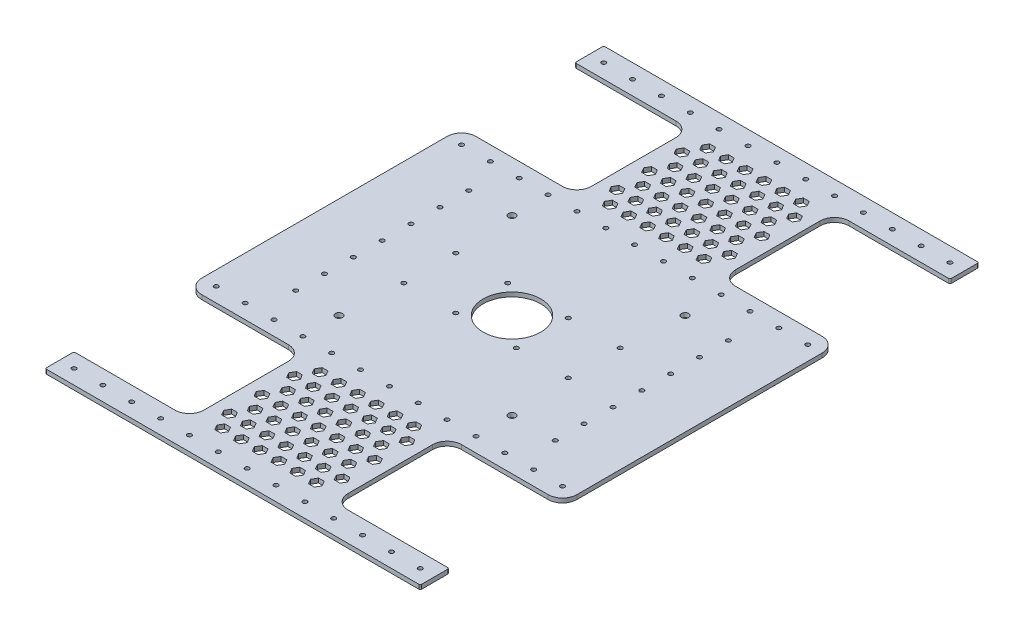
from build123d import *

# Parameters (mm, degrees)
EXTRUDE_1_DEPTH     = 3
CUT_EXTRUDE_2_DEPTH = 10
OTHER_1_DEPTH       = 3
FILLET_1_R          = 10
FILLET_2_R          = 1
SKETCH_5_R          = 1.5
CUT_EXTRUDE_3_DEPTH = 10
SKETCH_8_R          = 1.5
CUT_EXTRUDE_4_DEPTH = 234.216551728
SKETCH_11_R         = 20
CUT_EXTRUDE_6_DEPTH = 10
SKETCH_13_R         = 2.5
SKETCH_13_R_2       = 1.5
CUT_EXTRUDE_7_DEPTH = 10


# Read off the part's stored shape, not the designer's step: 填充阵列1
with BuildPart() as part:
    # 草图1 → 凸台-拉伸1 (new body)
    with BuildSketch(Plane(origin=(0, 0, 0), x_dir=(1, 0, 0), z_dir=(0, 1, 0))):
        with BuildLine():
            Line((-130, -193.6), (-50, -193.6))
            Line((-50, -193.6), (50, -193.6))
            Line((50, -193.6), (130, -193.6))
            Line((130, -193.6), (130, -173.6))
            Line((130, -173.6), (60, -173.6))
            ThreePointArc((60, -173.6), (52.928932188, -170.671067812), (50, -163.6))
            Line((50, -163.6), (50, -105))
            ThreePointArc((50, -105), (52.928932188, -97.928932188), (60, -95))
            Line((60, -95), (130, -95))
            Line((130, -95), (130, -75))
            Line((130, -75), (130, 75))
            Line((130, 75), (130, 95))
            Line((130, 95), (60, 95))
            ThreePointArc((60, 95), (52.928932188, 97.928932188), (50, 105))
            Line((50, 105), (50, 163.6))
            ThreePointArc((50, 163.6), (52.928932188, 170.671067812), (60, 173.6))
            Line((60, 173.6), (130, 173.6))
            Line((130, 173.6), (130, 193.6))
            Line((130, 193.6), (50, 193.6))
            Line((50, 193.6), (-50, 193.6))
            Line((-50, 193.6), (-130, 193.6))
            Line((-130, 193.6), (-130, 173.6))
            Line((-130, 173.6), (-60, 173.6))
            ThreePointArc((-60, 173.6), (-52.928932188, 170.671067812), (-50, 163.6))
            Line((-50, 163.6), (-50, 105))
            ThreePointArc((-50, 105), (-52.928932188, 97.928932188), (-60, 95))
            Line((-60, 95), (-130, 95))
            Line((-130, 95), (-130, 75))
            Line((-130, 75), (-130, -75))
            Line((-130, -75), (-130, -95))
            Line((-130, -95), (-60, -95))
            ThreePointArc((-60, -95), (-52.928932188, -97.928932188), (-50, -105))
            Line((-50, -105), (-50, -163.6))
            ThreePointArc((-50, -163.6), (-52.928932188, -170.671067812), (-60, -173.6))
            Line((-60, -173.6), (-130, -173.6))
            Line((-130, -173.6), (-130, -193.6))
        make_face()
    extrude(amount=EXTRUDE_1_DEPTH)

    # 草图4 → 切除-拉伸2 (cut)
    with BuildSketch(Plane(origin=(0, 3, 0), x_dir=(1, 0, 0), z_dir=(0, 1, 0))):
        Polygon((4, 134.3), (2, 137.764101615), (-2, 137.764101615), (-4, 134.3), (-2, 130.835898385), (2, 130.835898385), align=None)
    cut_extrude_2 = extrude(amount=-CUT_EXTRUDE_2_DEPTH, mode=Mode.SUBTRACT)

    # 填充阵列1 outline → 填充阵列1 (cut)
    with BuildSketch(Plane(origin=(0, 0, 0), x_dir=(1, 0, 0), z_dir=(0, 1, 0))):
        Polygon((-21.5, 97.060907637), (-17.5, 97.060907637), (-15.5, 100.525009252), (-17.5, 103.989110868), (-21.5, 103.989110868), (-23.5, 100.525009252), align=None)
        Polygon((-15, 108.319237886), (-11, 108.319237886), (-9, 111.783339502), (-11, 115.247441117), (-15, 115.247441117), (-17, 111.783339502), align=None)
        Polygon((-8.5, 119.577568136), (-4.5, 119.577568136), (-2.5, 123.041669751), (-4.5, 126.505771366), (-8.5, 126.505771366), (-10.5, 123.041669751), align=None)
        Polygon((4.5, 142.094228634), (8.5, 142.094228634), (10.5, 145.558330249), (8.5, 149.022431864), (4.5, 149.022431864), (2.5, 145.558330249), align=None)
        Polygon((11, 153.352558883), (15, 153.352558883), (17, 156.816660498), (15, 160.280762114), (11, 160.280762114), (9, 156.816660498), align=None)
        Polygon((17.5, 164.610889132), (21.5, 164.610889132), (23.5, 168.074990748), (21.5, 171.539092363), (17.5, 171.539092363), (15.5, 168.074990748), align=None)
        Polygon((22, 134.3), (24, 130.835898385), (28, 130.835898385), (30, 134.3), (28, 137.764101615), (24, 137.764101615), align=None)
        Polygon((35, 134.3), (37, 130.835898385), (41, 130.835898385), (43, 134.3), (41, 137.764101615), (37, 137.764101615), align=None)
        Polygon((-17, 134.3), (-15, 130.835898385), (-11, 130.835898385), (-9, 134.3), (-11, 137.764101615), (-15, 137.764101615), align=None)
        Polygon((-43, 134.3), (-41, 130.835898385), (-37, 130.835898385), (-35, 134.3), (-37, 137.764101615), (-41, 137.764101615), align=None)
        Polygon((-30, 134.3), (-28, 130.835898385), (-24, 130.835898385), (-22, 134.3), (-24, 137.764101615), (-28, 137.764101615), align=None)
        Polygon((9, 134.3), (11, 130.835898385), (15, 130.835898385), (17, 134.3), (15, 137.764101615), (11, 137.764101615), align=None)
        Polygon((17.5, 103.989110868), (15.5, 100.525009252), (17.5, 97.060907637), (21.5, 97.060907637), (23.5, 100.525009252), (21.5, 103.989110868), align=None)
        Polygon((11, 115.247441117), (9, 111.783339502), (11, 108.319237886), (15, 108.319237886), (17, 111.783339502), (15, 115.247441117), align=None)
        Polygon((-15, 160.280762114), (-17, 156.816660498), (-15, 153.352558883), (-11, 153.352558883), (-9, 156.816660498), (-11, 160.280762114), align=None)
        Polygon((-8.5, 149.022431864), (-10.5, 145.558330249), (-8.5, 142.094228634), (-4.5, 142.094228634), (-2.5, 145.558330249), (-4.5, 149.022431864), align=None)
        Polygon((-21.5, 171.539092363), (-23.5, 168.074990748), (-21.5, 164.610889132), (-17.5, 164.610889132), (-15.5, 168.074990748), (-17.5, 171.539092363), align=None)
        Polygon((4.5, 126.505771366), (2.5, 123.041669751), (4.5, 119.577568136), (8.5, 119.577568136), (10.5, 123.041669751), (8.5, 126.505771366), align=None)
        Polygon((-41, 153.352558883), (-37, 153.352558883), (-35, 156.816660498), (-37, 160.280762114), (-41, 160.280762114), (-43, 156.816660498), align=None)
        Polygon((-34.5, 164.610889132), (-30.5, 164.610889132), (-28.5, 168.074990748), (-30.5, 171.539092363), (-34.5, 171.539092363), (-36.5, 168.074990748), align=None)
        Polygon((35, 156.816660498), (37, 153.352558883), (41, 153.352558883), (43, 156.816660498), (41, 160.280762114), (37, 160.280762114), align=None)
        Polygon((-30, 156.816660498), (-28, 153.352558883), (-24, 153.352558883), (-22, 156.816660498), (-24, 160.280762114), (-28, 160.280762114), align=None)
        Polygon((22, 156.816660498), (24, 153.352558883), (28, 153.352558883), (30, 156.816660498), (28, 160.280762114), (24, 160.280762114), align=None)
        Polygon((-4, 156.816660498), (-2, 153.352558883), (2, 153.352558883), (4, 156.816660498), (2, 160.280762114), (-2, 160.280762114), align=None)
        Polygon((-21.5, 126.505771366), (-23.5, 123.041669751), (-21.5, 119.577568136), (-17.5, 119.577568136), (-15.5, 123.041669751), (-17.5, 126.505771366), align=None)
        Polygon((-34.5, 149.022431864), (-36.5, 145.558330249), (-34.5, 142.094228634), (-30.5, 142.094228634), (-28.5, 145.558330249), (-30.5, 149.022431864), align=None)
        Polygon((-8.5, 103.989110868), (-10.5, 100.525009252), (-8.5, 97.060907637), (-4.5, 97.060907637), (-2.5, 100.525009252), (-4.5, 103.989110868), align=None)
        Polygon((30.5, 142.094228634), (34.5, 142.094228634), (36.5, 145.558330249), (34.5, 149.022431864), (30.5, 149.022431864), (28.5, 145.558330249), align=None)
        Polygon((17.5, 119.577568136), (21.5, 119.577568136), (23.5, 123.041669751), (21.5, 126.505771366), (17.5, 126.505771366), (15.5, 123.041669751), align=None)
        Polygon((4.5, 97.060907637), (8.5, 97.060907637), (10.5, 100.525009252), (8.5, 103.989110868), (4.5, 103.989110868), (2.5, 100.525009252), align=None)
        Polygon((30.5, 171.539092363), (28.5, 168.074990748), (30.5, 164.610889132), (34.5, 164.610889132), (36.5, 168.074990748), (34.5, 171.539092363), align=None)
        Polygon((24, 108.319237886), (28, 108.319237886), (30, 111.783339502), (28, 115.247441117), (24, 115.247441117), (22, 111.783339502), align=None)
        Polygon((30.5, 119.577568136), (34.5, 119.577568136), (36.5, 123.041669751), (34.5, 126.505771366), (30.5, 126.505771366), (28.5, 123.041669751), align=None)
        Polygon((28.5, 100.525009252), (30.5, 97.060907637), (34.5, 97.060907637), (36.5, 100.525009252), (34.5, 103.989110868), (30.5, 103.989110868), align=None)
        Polygon((-36.5, 100.525009252), (-34.5, 97.060907637), (-30.5, 97.060907637), (-28.5, 100.525009252), (-30.5, 103.989110868), (-34.5, 103.989110868), align=None)
        Polygon((35, 111.783339502), (37, 108.319237886), (41, 108.319237886), (43, 111.783339502), (41, 115.247441117), (37, 115.247441117), align=None)
        Polygon((-30, 111.783339502), (-28, 108.319237886), (-24, 108.319237886), (-22, 111.783339502), (-24, 115.247441117), (-28, 115.247441117), align=None)
        Polygon((-43, 111.783339502), (-41, 108.319237886), (-37, 108.319237886), (-35, 111.783339502), (-37, 115.247441117), (-41, 115.247441117), align=None)
        Polygon((-4, 111.783339502), (-2, 108.319237886), (2, 108.319237886), (4, 111.783339502), (2, 115.247441117), (-2, 115.247441117), align=None)
        Polygon((-8.5, 171.539092363), (-10.5, 168.074990748), (-8.5, 164.610889132), (-4.5, 164.610889132), (-2.5, 168.074990748), (-4.5, 171.539092363), align=None)
        Polygon((-36.5, 123.041669751), (-34.5, 119.577568136), (-30.5, 119.577568136), (-28.5, 123.041669751), (-30.5, 126.505771366), (-34.5, 126.505771366), align=None)
        Polygon((17.5, 149.022431864), (15.5, 145.558330249), (17.5, 142.094228634), (21.5, 142.094228634), (23.5, 145.558330249), (21.5, 149.022431864), align=None)
        Polygon((4.5, 171.539092363), (2.5, 168.074990748), (4.5, 164.610889132), (8.5, 164.610889132), (10.5, 168.074990748), (8.5, 171.539092363), align=None)
        Polygon((-23.5, 145.558330249), (-21.5, 142.094228634), (-17.5, 142.094228634), (-15.5, 145.558330249), (-17.5, 149.022431864), (-21.5, 149.022431864), align=None)
    other_1 = extrude(amount=OTHER_1_DEPTH, mode=Mode.SUBTRACT)

    # 镜向1: 切除-拉伸2, 填充阵列1 across plane
    add(cut_extrude_2.mirror(Plane(origin=(0, 0, 0), x_dir=(1, 0, 0), z_dir=(0, 0, -1))), mode=Mode.SUBTRACT)
    add(other_1.mirror(Plane(origin=(0, 0, 0), x_dir=(1, 0, 0), z_dir=(0, 0, -1))), mode=Mode.SUBTRACT)

    # 圆角1
    fillet_1_edges = [part.edges().sort_by_distance(p)[0] for p in [
        (130, 1.5, -95),
        (130, 1.5, 95),
        (-130, 1.5, 95),
        (-130, 1.5, -95),
    ]]
    fillet(fillet_1_edges, radius=FILLET_1_R)

    # 圆角2
    fillet_2_edges = [part.edges().sort_by_distance(p)[0] for p in [
        (-130, 1.5, -173.6),
        (-130, 1.5, -193.6),
        (130, 1.5, -193.6),
        (130, 1.5, -173.6),
        (130, 1.5, 173.6),
        (130, 1.5, 193.6),
        (-130, 1.5, 193.6),
        (-130, 1.5, 173.6),
    ]]
    fillet(fillet_2_edges, radius=FILLET_2_R)

    # 草图5 → 切除-拉伸3 (cut)
    with BuildSketch(Plane(origin=(0, 3, 0), x_dir=(1, 0, 0), z_dir=(0, 1, 0))):
        with Locations(Location((0, 183.6, 0), (0, 0, 270))):
            Circle(SKETCH_5_R)
        with Locations(Location((20, 183.6, 0), (0, 0, 270))):
            Circle(SKETCH_5_R)
        with Locations(Location((40, 183.6, 0), (0, 0, 270))):
            Circle(SKETCH_5_R)
        with Locations(Location((60, 183.6, 0), (0, 0, 270))):
            Circle(SKETCH_5_R)
        with Locations(Location((80, 183.6, 0), (0, 0, 270))):
            Circle(SKETCH_5_R)
        with Locations(Location((100, 183.6, 0), (0, 0, 270))):
            Circle(SKETCH_5_R)
        with Locations(Location((120, 183.6, 0), (0, 0, 270))):
            Circle(SKETCH_5_R)
        with Locations((140, 183.6)):
            Circle(SKETCH_5_R)
        with Locations((160, 183.6)):
            Circle(SKETCH_5_R)
        with Locations((180, 183.6)):
            Circle(SKETCH_5_R)
        with Locations((200, 183.6)):
            Circle(SKETCH_5_R)
        with Locations((220, 183.6)):
            Circle(SKETCH_5_R)
        with Locations((240, 183.6)):
            Circle(SKETCH_5_R)
        with Locations((260, 183.6)):
            Circle(SKETCH_5_R)
        with Locations((280, 183.6)):
            Circle(SKETCH_5_R)
        with Locations(Location((-20, 183.6, 0), (0, 0, 270))):
            Circle(SKETCH_5_R)
        with Locations(Location((-40, 183.6, 0), (0, 0, 270))):
            Circle(SKETCH_5_R)
        with Locations(Location((-60, 183.6, 0), (0, 0, 270))):
            Circle(SKETCH_5_R)
        with Locations(Location((-80, 183.6, 0), (0, 0, 270))):
            Circle(SKETCH_5_R)
        with Locations(Location((-100, 183.6, 0), (0, 0, 270))):
            Circle(SKETCH_5_R)
        with Locations(Location((-120, 183.6, 0), (0, 0, 270))):
            Circle(SKETCH_5_R)
        with Locations((-140, 183.6)):
            Circle(SKETCH_5_R)
        with Locations((-160, 183.6)):
            Circle(SKETCH_5_R)
        with Locations((-180, 183.6)):
            Circle(SKETCH_5_R)
        with Locations((-200, 183.6)):
            Circle(SKETCH_5_R)
        with Locations((-220, 183.6)):
            Circle(SKETCH_5_R)
        with Locations((-240, 183.6)):
            Circle(SKETCH_5_R)
        with Locations((-240, -183.6)):
            Circle(SKETCH_5_R)
        with Locations((-220, -183.6)):
            Circle(SKETCH_5_R)
        with Locations((-200, -183.6)):
            Circle(SKETCH_5_R)
        with Locations((-180, -183.6)):
            Circle(SKETCH_5_R)
        with Locations((-160, -183.6)):
            Circle(SKETCH_5_R)
        with Locations((-140, -183.6)):
            Circle(SKETCH_5_R)
        with Locations(Location((-120, -183.6, 0), (0, 0, 270))):
            Circle(SKETCH_5_R)
        with Locations(Location((-100, -183.6, 0), (0, 0, 270))):
            Circle(SKETCH_5_R)
        with Locations(Location((-80, -183.6, 0), (0, 0, 270))):
            Circle(SKETCH_5_R)
        with Locations(Location((-60, -183.6, 0), (0, 0, 270))):
            Circle(SKETCH_5_R)
        with Locations(Location((-40, -183.6, 0), (0, 0, 270))):
            Circle(SKETCH_5_R)
        with Locations(Location((-20, -183.6, 0), (0, 0, 270))):
            Circle(SKETCH_5_R)
        with Locations(Location((40, -183.6, 0), (0, 0, 270))):
            Circle(SKETCH_5_R)
        with Locations(Location((20, -183.6, 0), (0, 0, 270))):
            Circle(SKETCH_5_R)
        with Locations(Location((0, -183.6, 0), (0, 0, 270))):
            Circle(SKETCH_5_R)
        with Locations(Location((60, -183.6, 0), (0, 0, 270))):
            Circle(SKETCH_5_R)
        with Locations(Location((80, -183.6, 0), (0, 0, 270))):
            Circle(SKETCH_5_R)
        with Locations(Location((100, -183.6, 0), (0, 0, 270))):
            Circle(SKETCH_5_R)
        with Locations(Location((120, -183.6, 0), (0, 0, 270))):
            Circle(SKETCH_5_R)
        with Locations((140, -183.6)):
            Circle(SKETCH_5_R)
        with Locations((160, -183.6)):
            Circle(SKETCH_5_R)
        with Locations((180, -183.6)):
            Circle(SKETCH_5_R)
        with Locations((200, -183.6)):
            Circle(SKETCH_5_R)
        with Locations((220, -183.6)):
            Circle(SKETCH_5_R)
        with Locations((240, -183.6)):
            Circle(SKETCH_5_R)
        with Locations((260, -183.6)):
            Circle(SKETCH_5_R)
        with Locations((280, -183.6)):
            Circle(SKETCH_5_R)
        with Locations((-240, 85)):
            Circle(SKETCH_5_R)
        with Locations((-220, 85)):
            Circle(SKETCH_5_R)
        with Locations((-200, 85)):
            Circle(SKETCH_5_R)
        with Locations((-180, 85)):
            Circle(SKETCH_5_R)
        with Locations((-160, 85)):
            Circle(SKETCH_5_R)
        with Locations((-140, 85)):
            Circle(SKETCH_5_R)
        with Locations(Location((-120, 85, 0), (0, 0, 270))):
            Circle(SKETCH_5_R)
        with Locations(Location((-100, 85, 0), (0, 0, 270))):
            Circle(SKETCH_5_R)
        with Locations(Location((-80, 85, 0), (0, 0, 270))):
            Circle(SKETCH_5_R)
        with Locations(Location((-60, 85, 0), (0, 0, 270))):
            Circle(SKETCH_5_R)
        with Locations(Location((-40, 85, 0), (0, 0, 270))):
            Circle(SKETCH_5_R)
        with Locations(Location((-20, 85, 0), (0, 0, 270))):
            Circle(SKETCH_5_R)
        with Locations(Location((40, 85, 0), (0, 0, 270))):
            Circle(SKETCH_5_R)
        with Locations(Location((20, 85, 0), (0, 0, 270))):
            Circle(SKETCH_5_R)
        with Locations(Location((0, 85, 0), (0, 0, 270))):
            Circle(SKETCH_5_R)
        with Locations(Location((60, 85, 0), (0, 0, 270))):
            Circle(SKETCH_5_R)
        with Locations(Location((80, 85, 0), (0, 0, 270))):
            Circle(SKETCH_5_R)
        with Locations(Location((100, 85, 0), (0, 0, 270))):
            Circle(SKETCH_5_R)
        with Locations(Location((120, 85, 0), (0, 0, 270))):
            Circle(SKETCH_5_R)
        with Locations((140, 85)):
            Circle(SKETCH_5_R)
        with Locations((160, 85)):
            Circle(SKETCH_5_R)
        with Locations((180, 85)):
            Circle(SKETCH_5_R)
        with Locations((200, 85)):
            Circle(SKETCH_5_R)
        with Locations((220, 85)):
            Circle(SKETCH_5_R)
        with Locations((240, 85)):
            Circle(SKETCH_5_R)
        with Locations((260, 85)):
            Circle(SKETCH_5_R)
        with Locations((280, 85)):
            Circle(SKETCH_5_R)
        with Locations(Location((0, -85, 0), (0, 0, 270))):
            Circle(SKETCH_5_R)
        with Locations(Location((20, -85, 0), (0, 0, 270))):
            Circle(SKETCH_5_R)
        with Locations(Location((40, -85, 0), (0, 0, 270))):
            Circle(SKETCH_5_R)
        with Locations(Location((60, -85, 0), (0, 0, 270))):
            Circle(SKETCH_5_R)
        with Locations(Location((80, -85, 0), (0, 0, 270))):
            Circle(SKETCH_5_R)
        with Locations(Location((100, -85, 0), (0, 0, 270))):
            Circle(SKETCH_5_R)
        with Locations(Location((120, -85, 0), (0, 0, 270))):
            Circle(SKETCH_5_R)
        with Locations((140, -85)):
            Circle(SKETCH_5_R)
        with Locations((160, -85)):
            Circle(SKETCH_5_R)
        with Locations((180, -85)):
            Circle(SKETCH_5_R)
        with Locations((200, -85)):
            Circle(SKETCH_5_R)
        with Locations((220, -85)):
            Circle(SKETCH_5_R)
        with Locations((240, -85)):
            Circle(SKETCH_5_R)
        with Locations((260, -85)):
            Circle(SKETCH_5_R)
        with Locations((280, -85)):
            Circle(SKETCH_5_R)
        with Locations(Location((-20, -85, 0), (0, 0, 270))):
            Circle(SKETCH_5_R)
        with Locations(Location((-40, -85, 0), (0, 0, 270))):
            Circle(SKETCH_5_R)
        with Locations(Location((-60, -85, 0), (0, 0, 270))):
            Circle(SKETCH_5_R)
        with Locations(Location((-80, -85, 0), (0, 0, 270))):
            Circle(SKETCH_5_R)
        with Locations(Location((-100, -85, 0), (0, 0, 270))):
            Circle(SKETCH_5_R)
        with Locations(Location((-120, -85, 0), (0, 0, 270))):
            Circle(SKETCH_5_R)
        with Locations((-140, -85)):
            Circle(SKETCH_5_R)
        with Locations((-160, -85)):
            Circle(SKETCH_5_R)
        with Locations((-180, -85)):
            Circle(SKETCH_5_R)
        with Locations((-200, -85)):
            Circle(SKETCH_5_R)
        with Locations((-220, -85)):
            Circle(SKETCH_5_R)
        with Locations((-240, -85)):
            Circle(SKETCH_5_R)
    extrude(amount=-CUT_EXTRUDE_3_DEPTH, mode=Mode.SUBTRACT)

    # 草图8 → 切除-拉伸4 (cut, through all)
    with BuildSketch(Plane(origin=(0, 3, 0), x_dir=(1, 0, 0), z_dir=(0, 1, 0))):
        with Locations(Location((-90.000000555, 0, 0), (0, 0, 270))):
            Circle(SKETCH_8_R)
        with Locations(Location((-90.000000555, -20, 0), (0, 0, 270))):
            Circle(SKETCH_8_R)
        with Locations(Location((-90.000000555, -40, 0), (0, 0, 270))):
            Circle(SKETCH_8_R)
        with Locations(Location((-90.000000555, -60, 0), (0, 0, 270))):
            Circle(SKETCH_8_R)
        with Locations(Location((89.999999445, 60, 0), (0, 0, 270))):
            Circle(SKETCH_8_R)
        with Locations(Location((89.999999445, 40, 0), (0, 0, 270))):
            Circle(SKETCH_8_R)
        with Locations(Location((89.999999445, 20, 0), (0, 0, 270))):
            Circle(SKETCH_8_R)
        with Locations(Location((89.999999445, 0, 0), (0, 0, 270))):
            Circle(SKETCH_8_R)
        with Locations(Location((89.999999445, -20, 0), (0, 0, 270))):
            Circle(SKETCH_8_R)
        with Locations(Location((89.999999445, -40, 0), (0, 0, 270))):
            Circle(SKETCH_8_R)
        with Locations(Location((89.999999445, -60, 0), (0, 0, 270))):
            Circle(SKETCH_8_R)
        with Locations(Location((-90.000000555, 20, 0), (0, 0, 270))):
            Circle(SKETCH_8_R)
        with Locations(Location((-90.000000555, 40, 0), (0, 0, 270))):
            Circle(SKETCH_8_R)
        with Locations(Location((-90.000000555, 60, 0), (0, 0, 270))):
            Circle(SKETCH_8_R)
    extrude(amount=-CUT_EXTRUDE_4_DEPTH, mode=Mode.SUBTRACT)

    # 草图11 → 切除-拉伸6 (cut)
    with BuildSketch(Plane.XZ):
        with Locations(Location((0, 0, 0), (0, 0, 270))):
            Circle(SKETCH_11_R)
    extrude(amount=-CUT_EXTRUDE_6_DEPTH, mode=Mode.SUBTRACT)

    # 草图13 → 切除-拉伸7 (cut)
    with BuildSketch(Plane(origin=(0, 3, 0), x_dir=(1, 0, 0), z_dir=(0, 1, 0))):
        with Locations(Location((60, 60, 0), (0, 0, 270))):
            Circle(SKETCH_13_R)
        with Locations(Location((60, -60, 0), (0, 0, 270))):
            Circle(SKETCH_13_R)
        with Locations(Location((-60, -60, 0), (0, 0, 270))):
            Circle(SKETCH_13_R)
        with Locations(Location((-60, 60, 0), (0, 0, 270))):
            Circle(SKETCH_13_R)
        with Locations(Location((-21, 18, 0), (0, 0, 270))):
            Circle(SKETCH_13_R_2)
        with Locations(Location((-21, -18, 0), (0, 0, 270))):
            Circle(SKETCH_13_R_2)
        with Locations(Location((-57, 18, 0), (0, 0, 270))):
            Circle(SKETCH_13_R_2)
        with Locations(Location((-57, -18, 0), (0, 0, 270))):
            Circle(SKETCH_13_R_2)
        with Locations(Location((57, -18, 0), (0, 0, 270))):
            Circle(SKETCH_13_R_2)
        with Locations(Location((57, 18, 0), (0, 0, 270))):
            Circle(SKETCH_13_R_2)
        with Locations(Location((21, -18, 0), (0, 0, 270))):
            Circle(SKETCH_13_R_2)
        with Locations(Location((21, 18, 0), (0, 0, 270))):
            Circle(SKETCH_13_R_2)
    extrude(amount=-CUT_EXTRUDE_7_DEPTH, mode=Mode.SUBTRACT)


solid = part.part
